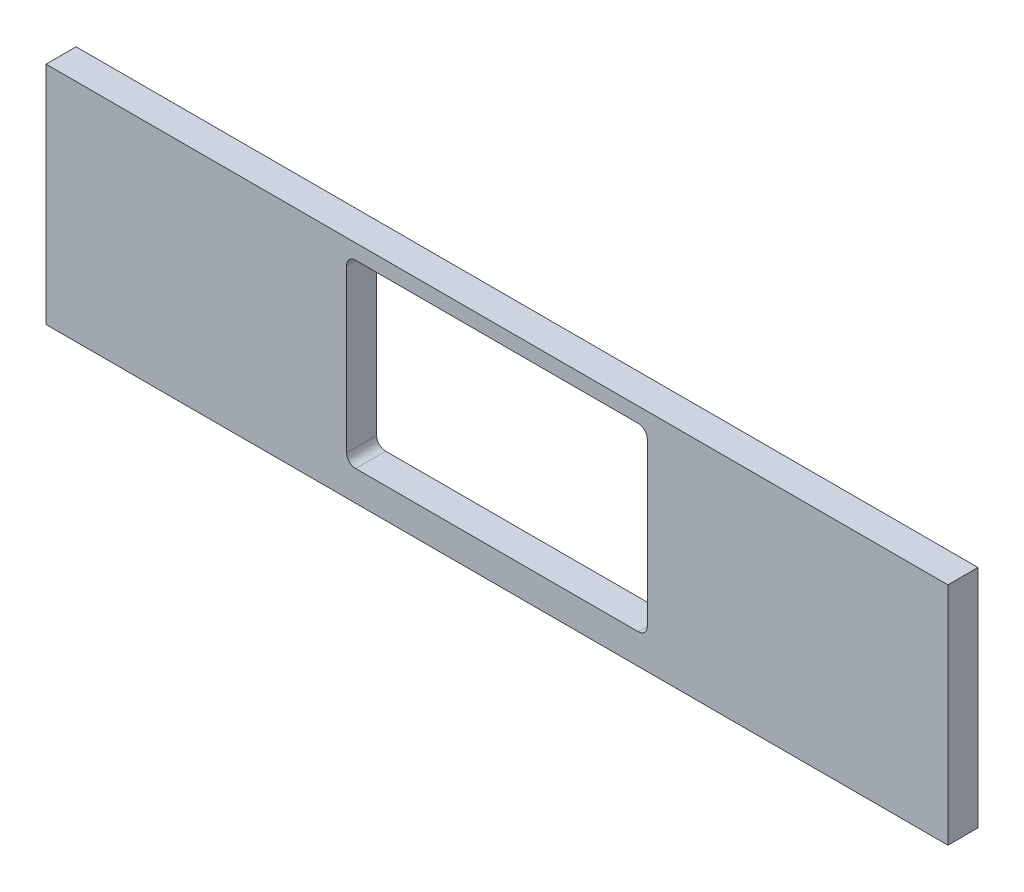
from build123d import *

# Parameters (mm, degrees)
SKIZZE1_W                       = 300
SKIZZE1_H                       = 75
LINEAR_AUSTRAGEN1_DEPTH         = 10
SKIZZE2_W                       = 100
SKIZZE2_H                       = 60
SCHNITT_LINEAR_AUSTRAGEN1_DEPTH = 10
VERRUNDUNG1_R                   = 3


with BuildPart() as part:
    # Skizze1 → Linear austragen1 (new body)
    with BuildSketch(Plane.XY):
        with Locations((0, -112.5)):
            Rectangle(SKIZZE1_W, SKIZZE1_H)
    extrude(amount=LINEAR_AUSTRAGEN1_DEPTH)

    # Skizze2 → Schnitt-Linear austragen1 (cut)
    with BuildSketch(Plane.XY.offset(10)):
        with Locations((0, -110)):
            Rectangle(SKIZZE2_W, SKIZZE2_H)
    extrude(amount=-SCHNITT_LINEAR_AUSTRAGEN1_DEPTH, mode=Mode.SUBTRACT)

    # Verrundung1
    verrundung1_edges = [part.edges().sort_by_distance(p)[0] for p in [
        (-50, -140, 5),
        (50, -140, 5),
        (-50, -80, 5),
        (50, -80, 5),
    ]]
    fillet(verrundung1_edges, radius=VERRUNDUNG1_R)


solid = part.part
